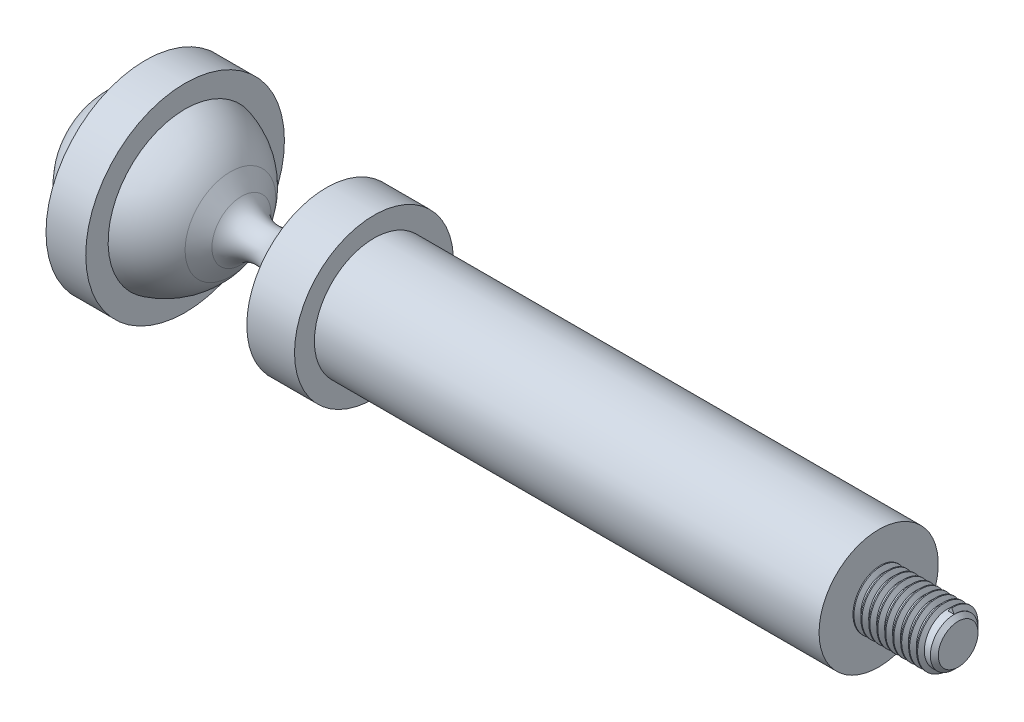
from build123d import *
from build123d.topology import SkipClean

# Parameters (mm, degrees)
CHAMFER1_SIZE = 0.5
THREAD2_PITCH = 1


with BuildPart() as part:
    # Sketch1 → Revolve1 (revolve)
    with BuildSketch(Plane.XY, mode=Mode.PRIVATE) as revolve1_sk:
        with BuildLine():
            Line((-29.322945736, 9.682458366), (-29.322945736, 12.5))
            Line((-29.322945736, 12.5), (-34.322945736, 12.5))
            Line((-34.322945736, 12.5), (-34.322945736, 9.682458366))
            ThreePointArc((-34.322945736, 9.682458366), (-39.728639887, 6.123724357), (-41.822945736, 0))
            Line((-41.822945736, 0), (67.944296128, 0))
            Line((67.944296128, 0), (67.944296128, 3))
            Line((67.944296128, 3), (57.944296128, 3))
            Line((57.944296128, 3), (57.944296128, 7.5))
            Line((57.944296128, 7.5), (-5.555703872, 7.5))
            Line((-5.555703872, 7.5), (-5.555703872, 10))
            Line((-5.555703872, 10), (-11.555703872, 10))
            Line((-11.555703872, 10), (-15.593261123, 3.813767398))
            ThreePointArc((-15.593261123, 3.813767398), (-18.884132699, 2.000432395), (-22.226899501, 3.716220748))
            Line((-22.226899501, 3.716220748), (-23.613061325, 5.70944813))
            ThreePointArc((-23.613061325, 5.70944813), (-26.111412789, 8.208434162), (-29.322945736, 9.682458366))
        make_face()
    revolve(revolve1_sk.sketch.rotate(Axis((-51.937984496, 0, 0), (1, 0, 0)), 90), axis=Axis((-51.937984496, 0, 0), (1, 0, 0)))

    # Chamfer1
    chamfer1_edges = [part.edges().sort_by_distance(p)[0] for p in [
        (67.944296128, 0, -3),
    ]]
    chamfer(chamfer1_edges, length=CHAMFER1_SIZE)

    # Thread2: the profile of Thread Profile3 profile screwed along a right-hand helix of 9.166667 turns, 8 arcs to a turn; built about Z, then put on its axis
    with SkipClean():  # the faces are left unmerged after this step: merging them gives an invalid solid
        thread2_z = Axis((0, 0, 0), (0, 0, 1))
        thread2_corners = [(2.9997, 0, -0.000173205), (3.541265875, 0, 0.312499999), (3.541265875, 0, 0.437499999), (2.9997, 0, 0.750173203)]
        with BuildLine(mode=Mode.PRIVATE) as thread2_profile:
            Line(thread2_corners[0], thread2_corners[1])
            Line(thread2_corners[1], thread2_corners[2])
            Line(thread2_corners[2], thread2_corners[3])
            Line(thread2_corners[3], thread2_corners[0])
        thread2_cap = Face(thread2_profile.wire())
        thread2_turn_angles = [0, 22.5, 45, 67.5, 90, 112.5, 135, 157.5, 180, 202.5, 225, 247.5, 270, 292.5, 315, 337.5, 360]
        thread2_turn_weights = [1, 0.9238795325112867, 1, 0.9238795325112867, 1, 0.9238795325112867, 1, 0.9238795325112867, 1, 0.9238795325112867, 1, 0.9238795325112867, 1, 0.9238795325112867, 1, 0.9238795325112867, 1]
        thread2_turn_rails = [Edge.make_bspline([Vector(p[0], p[1], 0).rotate(thread2_z, thread2_turn_angles[k]) / thread2_turn_weights[k] + Vector(0, 0, p[2] + THREAD2_PITCH * thread2_turn_angles[k] / 360) for k in range(17)], [0, 0, 0, 1, 1, 2, 2, 3, 3, 4, 4, 5, 5, 6, 6, 7, 7, 8, 8, 8], 2, thread2_turn_weights) for p in thread2_corners]
        thread2_turn_sides = [Face.make_surface_from_curves(thread2_turn_rails[p[0]], thread2_turn_rails[p[1]]) for p in [(0, 1), (1, 2), (2, 3), (3, 0)]]
        thread2_last_angles = [3240, 3262.5, 3285, 3292.5, 3300]
        thread2_last_weights = [1, 0.9238795325112867, 1, 0.9914448613738099, 1]
        thread2_last_rails = [Edge.make_bspline([Vector(p[0], p[1], 0).rotate(thread2_z, thread2_last_angles[k]) / thread2_last_weights[k] + Vector(0, 0, p[2] + THREAD2_PITCH * thread2_last_angles[k] / 360) for k in range(5)], [0, 0, 0, 1, 1, 2, 2, 2], 2, thread2_last_weights) for p in thread2_corners]
        thread2_last_sides = [Face.make_surface_from_curves(thread2_last_rails[p[0]], thread2_last_rails[p[1]]) for p in [(0, 1), (1, 2), (2, 3), (3, 0)]]
        thread2 = Plane(origin=(67.444296128, 0, 0), x_dir=(0, 1, 0), z_dir=(-1, 0, 0)) * Solid(Shell([*[p.moved(Location((0, 0, THREAD2_PITCH * i))) for i in range(9) for p in thread2_turn_sides], *thread2_last_sides, thread2_cap, thread2_cap.rotate(thread2_z, 3300).moved(Location((0, 0, THREAD2_PITCH * 3300 / 360)))]))
        add(thread2)


solid = part.part
